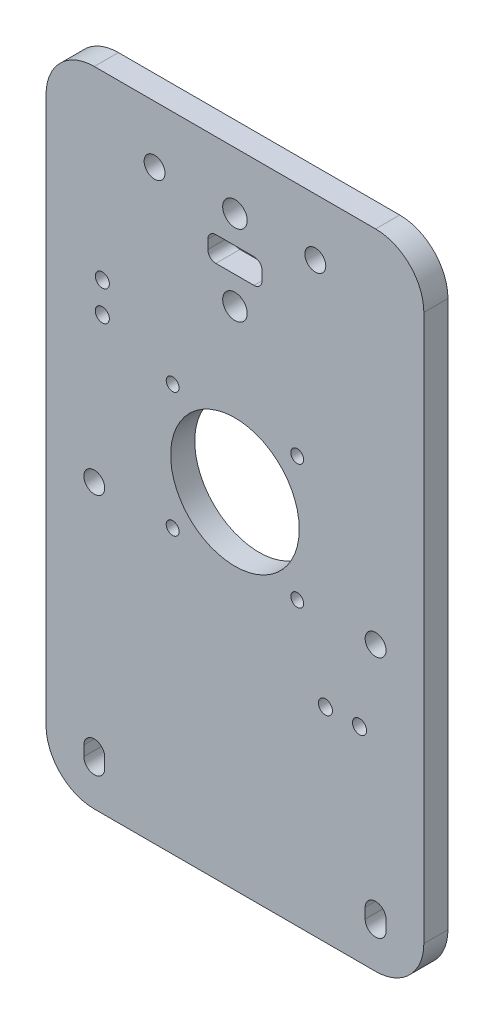
from build123d import *

# Parameters (mm, degrees)
MODEL_R                         = 2.6
MODEL_R_2                       = 16
MODEL_R_3                       = 3.05
MODEL_W                         = 13.5
MODEL_H                         = 6.2
BASE_DEPTH                      = 6
SKETCH1_R                       = 1.75
SENSORMOUNT_DEPTH               = 167.868211472
SKETCH2_R                       = 1.75
CABLEMOUNT_DEPTH                = 10
FILLETCABLESLOT_R               = 2
F_3_2_3_2_STEPPER_MOUNT_HOLES_D = 3.2


with BuildPart() as part:
    # Model → Base (new body)
    with BuildSketch(Plane.XY):
        with BuildLine():
            Line((35, 160), (-35, 160))
            ThreePointArc((-35, 160), (-43.485281374, 156.485281374), (-47, 148))
            Line((-47, 148), (-47, 12))
            ThreePointArc((-47, 12), (-43.485281374, 3.514718626), (-35, 0))
            Line((-35, 0), (35, 0))
            ThreePointArc((35, 0), (43.485281374, 3.514718626), (47, 12))
            Line((47, 12), (47, 148))
            ThreePointArc((47, 148), (43.485281374, 156.485281374), (35, 160))
        make_face()
        with BuildLine():
            ThreePointArc((-37.6, 12.5), (-35, 15.1), (-32.4, 12.5))
            Line((-32.4, 12.5), (-32.4, 10))
            ThreePointArc((-32.4, 10), (-35, 7.4), (-37.6, 10))
            Line((-37.6, 10), (-37.6, 12.5))
        make_face(mode=Mode.SUBTRACT)
        with Locations((-35, 70.45)):
            Circle(MODEL_R, mode=Mode.SUBTRACT)
        with BuildLine():
            Line((32.4, 10), (32.4, 12.5))
            ThreePointArc((32.4, 12.5), (35, 15.1), (37.6, 12.5))
            Line((37.6, 12.5), (37.6, 10))
            ThreePointArc((37.6, 10), (35, 7.4), (32.4, 10))
        make_face(mode=Mode.SUBTRACT)
        with Locations((35, 70.45)):
            Circle(MODEL_R, mode=Mode.SUBTRACT)
        with Locations((-20, 145.8)):
            Circle(MODEL_R, mode=Mode.SUBTRACT)
        with Locations((0, 85.8)):
            Circle(MODEL_R_2, mode=Mode.SUBTRACT)
        with Locations((0, 125.8)):
            Circle(MODEL_R_3, mode=Mode.SUBTRACT)
        with Locations((0, 135.8)):
            Rectangle(MODEL_W, MODEL_H, mode=Mode.SUBTRACT)
        with Locations((0, 145.8)):
            Circle(MODEL_R_3, mode=Mode.SUBTRACT)
        with Locations((20, 145.8)):
            Circle(MODEL_R, mode=Mode.SUBTRACT)
    extrude(amount=BASE_DEPTH)

    # Sketch1 → SensorMount (cut, through all)
    with BuildSketch(Plane.XY.offset(6)):
        with Locations((-33, 115)):
            Circle(SKETCH1_R)
        with Locations((-33, 107.5)):
            Circle(SKETCH1_R)
    extrude(amount=-SENSORMOUNT_DEPTH, mode=Mode.SUBTRACT)

    # Sketch2 → CableMount (cut)
    with BuildSketch(Plane.XY.offset(6)):
        with Locations((22.5, 50.76)):
            Circle(SKETCH2_R)
        with Locations((31, 50.76)):
            Circle(SKETCH2_R)
    extrude(amount=-CABLEMOUNT_DEPTH, mode=Mode.SUBTRACT)

    # FilletCableSlot
    filletcableslot_edges = [part.edges().sort_by_distance(p)[0] for p in [
        (6.75, 138.9, 3),
        (-6.75, 138.9, 3),
        (-6.75, 132.7, 3),
        (6.75, 132.7, 3),
    ]]
    fillet(filletcableslot_edges, radius=FILLETCABLESLOT_R)

    # Ø3.2 (3.2) Stepper mount Holes (through all)
    with Locations(Plane.XY.offset(6)):
        with Locations((-15.5, 101.3), (-15.5, 70.3), (15.5, 70.3), (15.5, 101.3)):
            Hole(F_3_2_3_2_STEPPER_MOUNT_HOLES_D / 2)


solid = part.part
